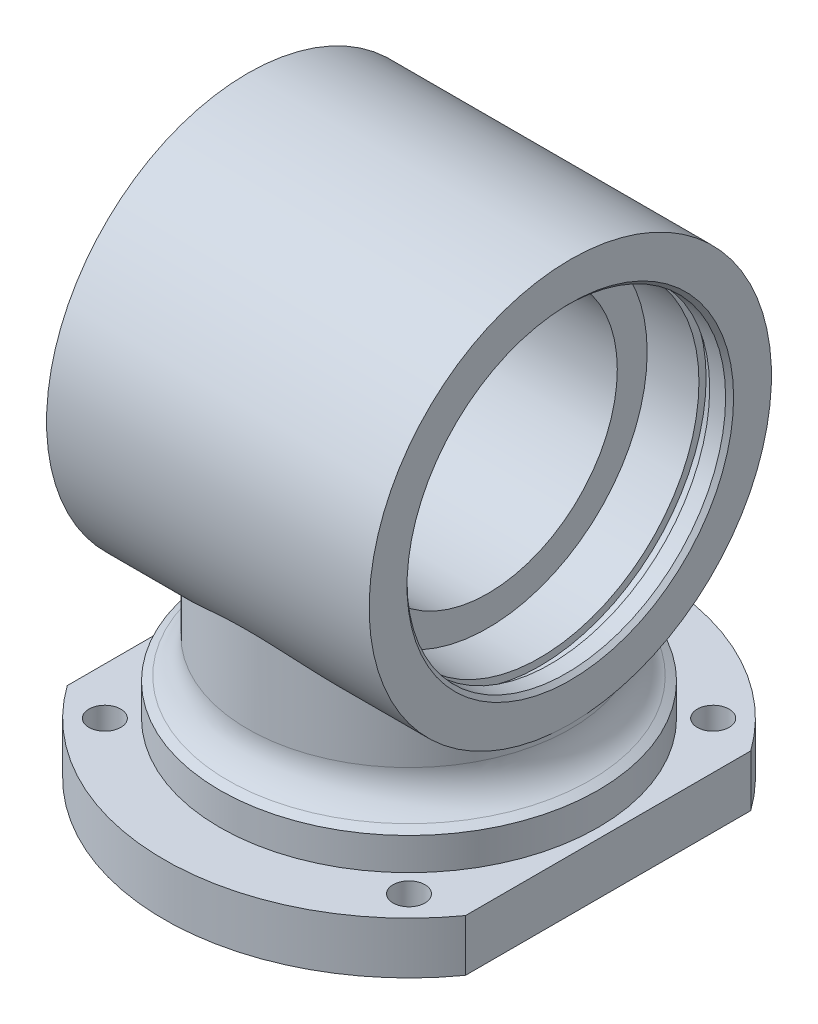
from build123d import *

# Parameters (mm, degrees)
SKETCH3_R           = 50.5
BOSS_EXTRUDE1_DEPTH = 40.5
SKETCH5_W           = 20
SKETCH5_H           = 130
CUT_EXTRUDE1_DEPTH  = 81
SKETCH9_R           = 4
CUT_EXTRUDE4_DEPTH  = 20
SKETCH10_R          = 42.5
CUT_EXTRUDE5_DEPTH  = 17
CHAMFER1_SIZE       = 1
CHAMFER2_SIZE       = 3
CUT_EXTRUDE8_START  = -13
SKETCH13_OUTSIDE_W  = 143.386
SKETCH13_OUTSIDE_H  = 166.386
SKETCH13_OUTSIDE_R  = 47.5
CUT_EXTRUDE8_DEPTH  = 10


with BuildPart() as part:
    # Sketch1 → Revolve1 (revolve)
    with BuildSketch(Plane.XY, mode=Mode.PRIVATE) as revolve1_sk:
        with BuildLine():
            Line((0, 0), (-61.5, 0))
            Line((-61.5, 0), (-61.5, 13))
            Line((-61.5, 13), (-45.5, 22.237604307))
            ThreePointArc((-45.5, 22.237604307), (-41.839745962, 25.897858345), (-40.5, 30.897858345))
            Line((-40.5, 30.897858345), (-40.5, 80))
            Line((-40.5, 80), (0, 80))
            Line((0, 80), (0, 0))
        make_face()
    revolve(revolve1_sk.sketch.rotate(Axis((0, 0, 0), (0, 1, 0)), 270), axis=Axis((0, 0, 0), (0, 1, 0)))

    # Sketch3 → Boss-Extrude1 (add, symmetric)
    with BuildSketch(Plane(origin=(0, 0, 0), x_dir=(0, 0, -1), z_dir=(1, 0, 0))):
        with Locations((0, 82.5)):
            Circle(SKETCH3_R)
    extrude(amount=BOSS_EXTRUDE1_DEPTH, both=True)

    # Sketch5 → Cut-Extrude1 (cut)
    with BuildSketch(Plane.XZ):
        with Locations((60, 0)):
            Rectangle(SKETCH5_W, SKETCH5_H)
        with Locations((-60, 0)):
            Rectangle(SKETCH5_W, SKETCH5_H)
    extrude(amount=-CUT_EXTRUDE1_DEPTH, mode=Mode.SUBTRACT)

    # Sketch6 → Cut-Revolve1 (revolve, cut)
    with BuildSketch(Plane.XY, mode=Mode.PRIVATE) as cut_revolve1_sk:
        Polygon((-35.5, 122.5), (-40.5, 122.5), (-40.5, 82.5), (40.5, 82.5), (40.5, 122.5), (35.5, 122.5), (35.5, 124.3), (32.8, 124.3), (32.8, 122.5), (19.8, 122.5), (19.8, 115), (-19.8, 115), (-19.8, 122.5), (-32.8, 122.5), (-32.8, 124.3), (-35.5, 124.3), align=None)
    revolve(cut_revolve1_sk.sketch.rotate(Axis((40.5, 82.5, 0), (1, 0, 0)), 90), axis=Axis((40.5, 82.5, 0), (1, 0, 0)), mode=Mode.SUBTRACT)

    # Sketch9 → Cut-Extrude4 (cut)
    with BuildSketch(Plane.XZ):
        with Locations(Location((38.183766184, 38.183766184, 0), (0, 0, 270))):
            Circle(SKETCH9_R)
        with Locations(Location((-38.183766184, 38.183766184, 0), (0, 0, 270))):
            Circle(SKETCH9_R)
        with Locations(Location((-38.183766184, -38.183766184, 0), (0, 0, 270))):
            Circle(SKETCH9_R)
        with Locations(Location((38.183766184, -38.183766184, 0), (0, 0, 270))):
            Circle(SKETCH9_R)
    extrude(amount=-CUT_EXTRUDE4_DEPTH, mode=Mode.SUBTRACT)

    # Sketch10 → Cut-Extrude5 (cut)
    with BuildSketch(Plane.XZ):
        with Locations(Location((0, 0, 0), (0, 0, 270))):
            Circle(SKETCH10_R)
    extrude(amount=-CUT_EXTRUDE5_DEPTH, mode=Mode.SUBTRACT)

    # Chamfer1
    # the kernel refuses this chamfer: 1 mm, written as the material it takes off along each edge
    with BuildSketch(Plane(origin=(-40.5, 82.5, 0), x_dir=(0, -1, 0), z_dir=(0, 0, 1))) as chamfer1_piece_1:
        Polygon((40 + CHAMFER1_SIZE, 0), (40, CHAMFER1_SIZE), (40, 0), align=None)
    revolve(axis=Axis((-40.5, 82.5, 0), (1, 0, 0)), revolution_arc=270, mode=Mode.SUBTRACT)
    with BuildSketch(Plane(origin=(40.5, 82.5, 0), x_dir=(0, -1, 0), z_dir=(0, 0, 1))) as chamfer1_piece_2:
        Polygon((40 + CHAMFER1_SIZE, 0), (40, -CHAMFER1_SIZE), (40, 0), align=None)
    revolve(axis=Axis((40.5, 82.5, 0), (1, 0, 0)), revolution_arc=270, mode=Mode.SUBTRACT)
    with BuildSketch(Plane(origin=(40.5, 82.5, 0), x_dir=(0, 0, 1), z_dir=(0, 1, 0))) as chamfer1_piece_3:
        Polygon((40 + CHAMFER1_SIZE, 0), (40, -CHAMFER1_SIZE), (40, 0), align=None)
    revolve(axis=Axis((40.5, 82.5, 0), (1, 0, 0)), revolution_arc=90, mode=Mode.SUBTRACT)
    with BuildSketch(Plane(origin=(-40.5, 82.5, 0), x_dir=(0, 0, 1), z_dir=(0, 1, 0))) as chamfer1_piece_4:
        Polygon((40 + CHAMFER1_SIZE, 0), (40, CHAMFER1_SIZE), (40, 0), align=None)
    revolve(axis=Axis((-40.5, 82.5, 0), (1, 0, 0)), revolution_arc=90, mode=Mode.SUBTRACT)

    # Chamfer2
    chamfer2_edges = [part.edges().sort_by_distance(p)[0] for p in [
        (0, 17, 42.5),
    ]]
    chamfer(chamfer2_edges, length=CHAMFER2_SIZE)

    # Sketch13 outside → Cut-Extrude8 (cut)
    with BuildSketch(Plane.XZ.offset(CUT_EXTRUDE8_START)):
        Rectangle(SKETCH13_OUTSIDE_W, SKETCH13_OUTSIDE_H)
        with Locations(Location((0, 0, 0), (0, 0, 270))):
            Circle(SKETCH13_OUTSIDE_R, mode=Mode.SUBTRACT)
    extrude(amount=-CUT_EXTRUDE8_DEPTH, mode=Mode.SUBTRACT)


solid = part.part
